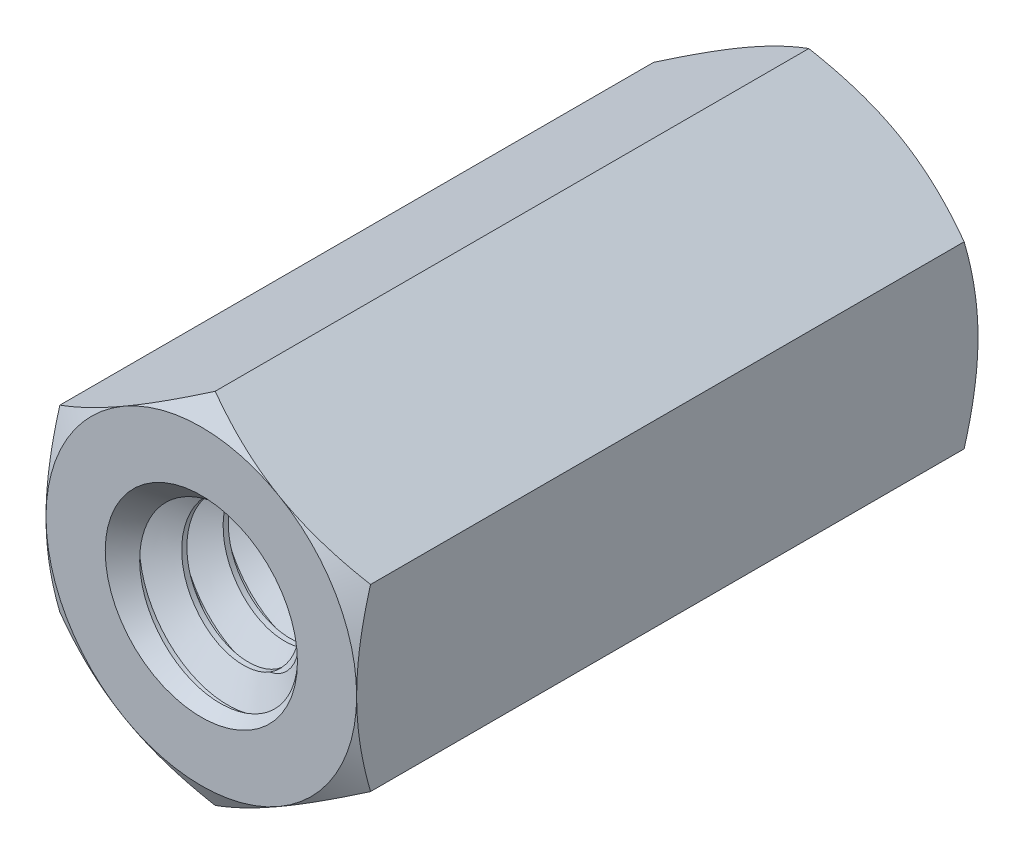
from build123d import *

# Parameters (mm, degrees)
EXTRUDE1_DEPTH          = 4.7625
EXTRUDE1_DEPTH_BACK     = 4.7625
SKETCH1_R               = 1.4224
SWEEP1_PITCH            = 0.635
EXTRUDE2_DEPTH          = 11.791660805
SKETCH8_OUTSIDE_W       = 50.108
SKETCH8_OUTSIDE_H       = 50.846
SKETCH8_OUTSIDE_R       = 2.38125
EXTRUDE4_DEPTH          = 11.791660805
EXTRUDE4_DRAFT          = -60
MIRROR1_COPY_1_SKETCH_W = 50.108
MIRROR1_COPY_1_SKETCH_H = 50.846
MIRROR1_COPY_1_SKETCH_R = 2.38125
MIRROR1_COPY_1_DEPTH    = 11.791660805
MIRROR1_COPY_1_DRAFT    = -60


with BuildPart() as part:
    # Sketch1 → Extrude1 (new, two sides: drawn at the far end of the back side and taken through both)
    with BuildSketch(Plane.XY.offset(-EXTRUDE1_DEPTH_BACK)):
        Polygon((0, 2.749630657), (-2.38125, 1.374815329), (-2.38125, -1.374815329), (0, -2.749630657), (2.38125, -1.374815329), (2.38125, 1.374815329), align=None)
        with Locations(Location((0, 0, 0), (0, 0, 180))):
            Circle(SKETCH1_R, mode=Mode.SUBTRACT)
    extrude(amount=EXTRUDE1_DEPTH + EXTRUDE1_DEPTH_BACK)

    # Sweep1: the profile of Sketch12 profile screwed along a right-hand helix of 16 turns, 6 arcs to a turn; built about Z, then put on its axis
    sweep1_z = Axis((0, 0, 0), (0, 0, 1))
    sweep1_corners = [(1.4227, 0, -0.555798205), (1.4227, 0, 0.000173205), (1.009955401, 0, -0.238125), (1.009955401, 0, -0.3175)]
    with BuildLine(mode=Mode.PRIVATE) as sweep1_profile:
        Line(sweep1_corners[0], sweep1_corners[1])
        Line(sweep1_corners[1], sweep1_corners[2])
        Line(sweep1_corners[2], sweep1_corners[3])
        Line(sweep1_corners[3], sweep1_corners[0])
    sweep1_cap = Face(sweep1_profile.wire())
    sweep1_turn_angles = [0, 30, 60, 90, 120, 150, 180, 210, 240, 270, 300, 330, 360]
    sweep1_turn_weights = [1, 0.8660254037844387, 1, 0.8660254037844387, 1, 0.8660254037844387, 1, 0.8660254037844387, 1, 0.8660254037844387, 1, 0.8660254037844387, 1]
    sweep1_turn_rails = [Edge.make_bspline([Vector(p[0], p[1], 0).rotate(sweep1_z, sweep1_turn_angles[k]) / sweep1_turn_weights[k] + Vector(0, 0, p[2] + SWEEP1_PITCH * sweep1_turn_angles[k] / 360) for k in range(13)], [0, 0, 0, 1, 1, 2, 2, 3, 3, 4, 4, 5, 5, 6, 6, 6], 2, sweep1_turn_weights) for p in sweep1_corners]
    sweep1_turn_sides = [Face.make_surface_from_curves(sweep1_turn_rails[p[0]], sweep1_turn_rails[p[1]]) for p in [(0, 1), (1, 2), (2, 3), (3, 0)]]
    sweep1 = Plane(origin=(0, 0, -4.7625), x_dir=(0, 1, 0), z_dir=(0, 0, 1)) * Solid(Shell([*[p.moved(Location((0, 0, SWEEP1_PITCH * i))) for i in range(16) for p in sweep1_turn_sides], sweep1_cap, sweep1_cap.rotate(sweep1_z, 5760).moved(Location((0, 0, SWEEP1_PITCH * 5760 / 360)))]))
    add(sweep1)

    # Sketch6 → Extrude2 (cut, through all)
    with BuildSketch(Plane(origin=(0, 0, -4.7625), x_dir=(-1, 0, 0), z_dir=(0, 0, -1))):
        Polygon((0, 2.749630657), (-2.38125, 1.374815329), (-2.38125, -1.374815329), (0, -2.749630657), (2.38125, -1.374815329), (2.38125, 1.374815329), align=None)
    extrude2 = extrude(amount=EXTRUDE2_DEPTH, mode=Mode.SUBTRACT)

    # Extrude3 cone 1 section (through the dimple's axis) → Extrude3 (revolve, cut)
    with BuildSketch(Plane(origin=(0, 0, -4.7625), x_dir=(0, 1, 0), z_dir=(1, 0, 0))):
        Polygon((0, 0), (1.4732, 0), (0, 1.579813584), align=None)
    extrude3 = revolve(axis=Axis((0, 0, -4.7625), (0, 0, 1)), mode=Mode.SUBTRACT)


with BuildPart() as extrude4_tool:
    # Sketch8 outside → Extrude4 (with draft: the straight prism first)
    with BuildSketch(Plane(origin=(0, 0, -4.7625), x_dir=(-1, 0, 0), z_dir=(0, 0, -1))):
        Rectangle(SKETCH8_OUTSIDE_W, SKETCH8_OUTSIDE_H)
        Circle(SKETCH8_OUTSIDE_R, mode=Mode.SUBTRACT)
    extrude(amount=-EXTRUDE4_DEPTH)
    # Extrude4: the draft: its side faces are tilted about the plane it starts from
    extrude4_sides = [extrude4_tool.faces().sort_by_distance(p)[0] for p in [
        (0, -25.423, 1.133330402),
        (-25.054, 0, 1.133330402),
        (0, 25.423, 1.133330402),
        (25.054, 0, 1.133330402),
        (2.38125, 0, 1.133330402),
    ]]
    draft(extrude4_sides, Plane(origin=(0, 0, -4.7625), x_dir=(-1, 0, 0), z_dir=(0, 0, -1)), EXTRUDE4_DRAFT)


with BuildPart() as part_1:
    add(part.part)

    # Extrude4: cut by extrude4_tool
    add(extrude4_tool.part, mode=Mode.SUBTRACT)

    # Mirror1: Extrude2, Extrude3 across plane
    add(extrude2.mirror(Plane.XY), mode=Mode.SUBTRACT)
    add(extrude3.mirror(Plane.XY), mode=Mode.SUBTRACT)


with BuildPart() as mirror1_copy_1_tool:
    # Mirror1 copy 1 sketch → Mirror1 copy 1 (with draft: the straight prism first)
    with BuildSketch(Plane(origin=(0, 0, 4.7625), x_dir=(-1, 0, 0), z_dir=(0, 0, 1))):
        Rectangle(MIRROR1_COPY_1_SKETCH_W, MIRROR1_COPY_1_SKETCH_H)
        Circle(MIRROR1_COPY_1_SKETCH_R, mode=Mode.SUBTRACT)
    extrude(amount=-MIRROR1_COPY_1_DEPTH)
    # Mirror1 copy 1: the draft: its side faces are tilted about the plane it starts from
    mirror1_copy_1_sides = [mirror1_copy_1_tool.faces().sort_by_distance(p)[0] for p in [
        (0, -25.423, -1.133330402),
        (-25.054, 0, -1.133330402),
        (0, 25.423, -1.133330402),
        (25.054, 0, -1.133330402),
        (2.38125, 0, -1.133330402),
    ]]
    draft(mirror1_copy_1_sides, Plane(origin=(0, 0, 4.7625), x_dir=(-1, 0, 0), z_dir=(0, 0, 1)), MIRROR1_COPY_1_DRAFT)


with BuildPart() as part_2:
    add(part_1.part)

    # Mirror1 copy 1: cut by mirror1_copy_1_tool
    add(mirror1_copy_1_tool.part, mode=Mode.SUBTRACT)


solid = part_2.part
